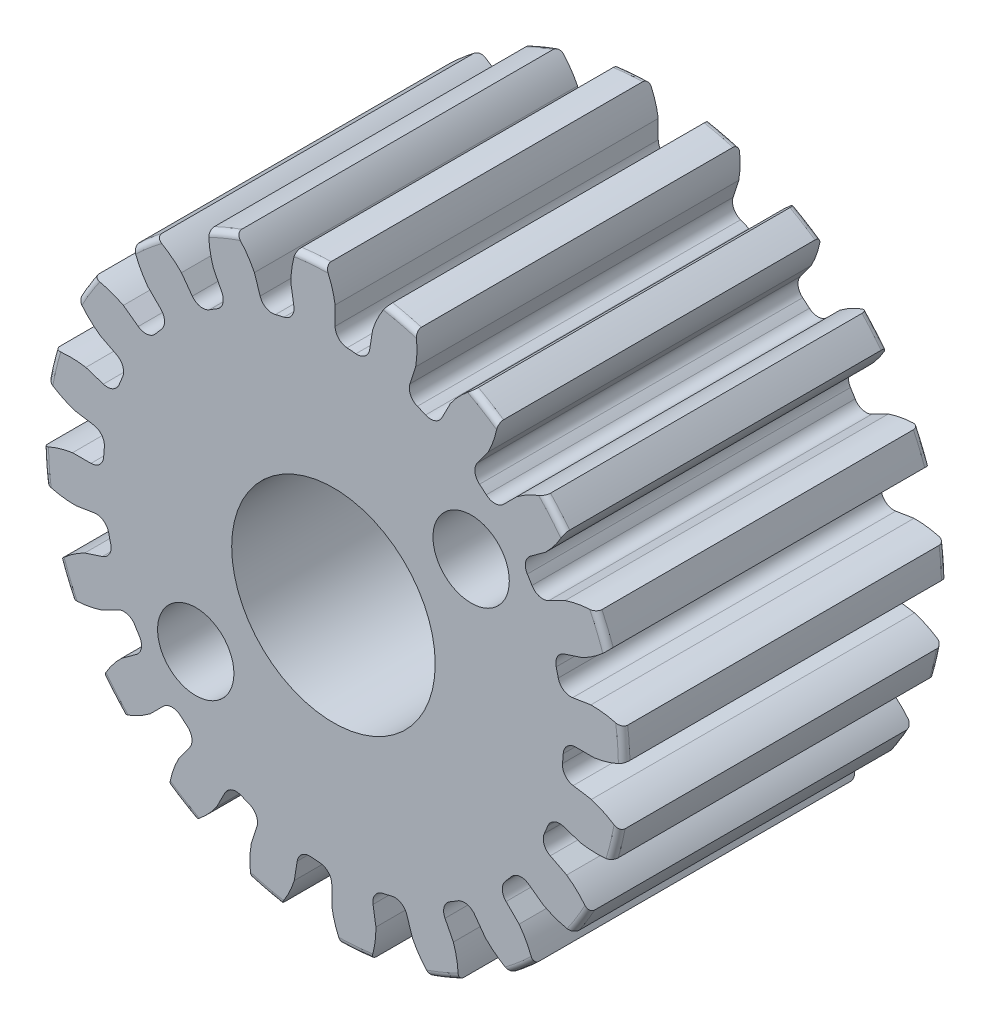
from build123d import *

# Parameters (mm, degrees)
SKETCH1_R           = 5.715
BOSS_EXTRUDE1_DEPTH = 6.35
SKETCH2_W           = 6.35
SKETCH2_H           = 4.7625
FILLET2_R           = 0.1143
CUT_EXTRUDE1_DEPTH  = 6.35
FILLET1_R           = 0.249563992
CIRPATTERN1_START   = -6.35
CIRPATTERN1_DEPTH   = 6.35
SKETCH5_R           = 2
CUT_EXTRUDE2_DEPTH  = 13.489891652
CHAMFER1_SIZE       = 0.238125
CUT_EXTRUDE3_START  = -3.175
SKETCH6_R           = 4.7625
CUT_EXTRUDE3_DEPTH  = 3.175
SKETCH7_R           = 2.238125
SKETCH7_R_2         = 2
BOSS_EXTRUDE2_DEPTH = 6.35
SKETCH8_R           = 0.75
CUT_EXTRUDE4_DEPTH  = 11.275907246


# Read off the part's stored shape, not the designer's step: CirPattern1
with BuildPart() as part:
    # Sketch1 → Boss-Extrude1 (new body)
    with BuildSketch(Plane.XY):
        Circle(SKETCH1_R)
    extrude(amount=-BOSS_EXTRUDE1_DEPTH)

    # Sketch2 → Revolve1 (revolve)
    with BuildSketch(Plane(origin=(0, 0, 0), x_dir=(0, 0, -1), z_dir=(1, 0, 0)), mode=Mode.PRIVATE) as revolve1_sk:
        with Locations((6.35, 2.38125)):
            Rectangle(SKETCH2_W, SKETCH2_H)
    revolve(revolve1_sk.sketch.rotate(Axis((0, 0, -3.175), (0, 0, -1)), 90), axis=Axis((0, 0, -3.175), (0, 0, -1)))

    # Fillet2
    fillet2_edges = [part.edges().sort_by_distance(p)[0] for p in [
        (-5.715, 0, 0),
        (-5.715, 0, -6.35),
    ]]
    fillet(fillet2_edges, radius=FILLET2_R)

    # Sketch4 → Cut-Extrude1 (cut)
    with BuildSketch(Plane.XY):
        with BuildLine():
            Line((0.033105528, 5.127106209), (0.033105528, 4.523301354))
            ThreePointArc((0.033105528, 4.523301354), (0.354904467, 4.509478233), (0.674903926, 4.472790606))
            Line((0.674903926, 4.472790606), (0.769360035, 5.069161587))
            add(Edge.make_bspline(
                [(1.504694003, 6.05479747), (0.955155709, 5.660253512), (0.769360035, 5.069161587)],
                knots=[0, 0, 0, 1, 1, 1], degree=2))
            ThreePointArc((1.504694003, 6.05479747), (0.489504645, 6.219731638), (-0.538987437, 6.215639065))
            add(Edge.make_bspline(
                [(-0.538987437, 6.215639065), (-0.057935318, 5.739985693), (0.033105528, 5.127106209)],
                knots=[0, 0, 0, 1, 1, 1], degree=2))
        make_face()
    extrude(amount=-CUT_EXTRUDE1_DEPTH, mode=Mode.SUBTRACT)

    # Fillet1
    # the kernel refuses this fillet: 0.249563992 mm, written as the material it adds along each edge
    with BuildSketch(Plane(origin=(0.674903926, 4.472790606, 0), x_dir=(-0.9923475631458823, 0.12347596494228733, 0), z_dir=(0, 0, -1))) as fillet1_piece_1:
        with BuildLine():
            CenterArc((0.241394546, 0.249479842), FILLET1_R * 0.999999998397, 181.907267855, 86.6047981)
            Line((-0.008031187, 0.241173865), (0, 0))
            ThreePointArc((0, 0), (0.11745713, 0.001525228), (0.234914261, 0))
        make_face()
    extrude(amount=6.35)
    with BuildSketch(Plane(origin=(0.033105528, 4.523301354, 0), x_dir=(0, 1, 0), z_dir=(0, 0, -1))) as fillet1_piece_2:
        with BuildLine():
            CenterArc((0.241307548, 0.249563992), FILLET1_R * 0.999999998397, 183.3952019, 86.6047981)
            ThreePointArc((-0.007818406, 0.234784119), (-0.00238482, 0.117442822), (0, 0))
            Line((0, 0), (0.241307548, 0))
        make_face()
    extrude(amount=6.35)

    # CirPattern1 outline → CirPattern1 (cut)
    with BuildSketch(Plane.XY.offset(CIRPATTERN1_START)):
        with BuildLine():
            Line((-0.778045262, 4.7007701), (-0.834752203, 5.058804485))
            add(Edge.make_bspline(
                [(-0.834752203, 5.058804485), (-0.837768738, 5.372639768), (-0.736442204, 5.667353642)],
                knots=[0, 0, 0, 0.506532467, 0.506532467, 0.506532467], degree=2))
            ThreePointArc((-0.736442204, 5.667353642), (-1.334139234, 5.557094341), (-1.916747356, 5.383985939))
            add(Edge.make_bspline(
                [(-1.916747356, 5.383985939), (-1.692668104, 5.167396755), (-1.552877722, 4.886397941)],
                knots=[0.493467533, 0.493467533, 0.493467533, 1, 1, 1], degree=2))
            Line((-1.552877722, 4.886397941), (-1.440859894, 4.541642515))
            ThreePointArc((-1.440859894, 4.541642515), (-1.32334776, 4.399852914), (-1.140582774, 4.377261935))
            ThreePointArc((-1.140582774, 4.377261935), (-1.055971203, 4.39844017), (-0.970967017, 4.417983043))
            ThreePointArc((-0.970967017, 4.417983043), (-0.818378274, 4.521085263), (-0.778045262, 4.7007701))
        make_face()
        with BuildLine():
            add(Edge.make_bspline(
                [(2.298161952, 4.583313834), (2.480189275, 4.838984986), (2.735392631, 5.017855276)],
                knots=[0, 0, 0, 0.506532467, 0.506532467, 0.506532467], degree=2))
            ThreePointArc((2.735392631, 5.017855276), (2.187036785, 5.279971125), (1.613946348, 5.482371948))
            add(Edge.make_bspline(
                [(1.613946348, 5.482371948), (1.667922343, 5.17543714), (1.615848179, 4.865937599)],
                knots=[0.493467533, 0.493467533, 0.493467533, 1, 1, 1], degree=2))
            Line((1.615848179, 4.865937599), (1.503830351, 4.521182173))
            ThreePointArc((1.503830351, 4.521182173), (1.515557827, 4.337400077), (1.650139163, 4.211697028))
            ThreePointArc((1.650139163, 4.211697028), (1.731039616, 4.179097147), (1.811296459, 4.144943456))
            ThreePointArc((1.811296459, 4.144943456), (1.995345311, 4.138665491), (2.1335915, 4.260326429))
            Line((2.1335915, 4.260326429), (2.298161952, 4.583313834))
        make_face()
        with BuildLine():
            add(Edge.make_bspline(
                [(3.602003765, 3.648819389), (3.854128768, 3.835727568), (4.152115542, 3.926981149)],
                knots=[0, 0, 0, 0.506532467, 0.506532467, 0.506532467], degree=2))
            ThreePointArc((4.152115542, 3.926981149), (3.711596393, 4.34571941), (3.229100292, 4.715308716))
            add(Edge.make_bspline(
                [(3.229100292, 4.715308716), (3.185586443, 4.406716867), (3.040420352, 4.128457114)],
                knots=[0.493467533, 0.493467533, 0.493467533, 1, 1, 1], degree=2))
            Line((3.040420352, 4.128457114), (2.827349781, 3.835190632))
            ThreePointArc((2.827349781, 3.835190632), (2.781711483, 3.656779483), (2.870861561, 3.495640859))
            ThreePointArc((2.870861561, 3.495640859), (2.937728546, 3.439636914), (3.003503269, 3.382354095))
            ThreePointArc((3.003503269, 3.382354095), (3.176604131, 3.319509174), (3.345679367, 3.392495179))
            Line((3.345679367, 3.392495179), (3.602003765, 3.648819389))
        make_face()
        with BuildLine():
            add(Edge.make_bspline(
                [(4.553256353, 2.357153079), (4.850799284, 2.45700241), (5.162400454, 2.451706746)],
                knots=[0, 0, 0, 0.506532467, 0.506532467, 0.506532467], degree=2))
            ThreePointArc((5.162400454, 2.451706746), (4.872839085, 2.986078401), (4.5281674, 3.486678213))
            add(Edge.make_bspline(
                [(4.5281674, 3.486678213), (4.391423146, 3.206636444), (4.167374997, 2.986854482)],
                knots=[0.493467533, 0.493467533, 0.493467533, 1, 1, 1], degree=2))
            Line((4.167374997, 2.986854482), (3.874108515, 2.773783911))
            ThreePointArc((3.874108515, 2.773783911), (3.775571837, 2.618207834), (3.810564026, 2.437407007))
            ThreePointArc((3.810564026, 2.437407007), (3.856852138, 2.363481056), (3.901706252, 2.28867635))
            ThreePointArc((3.901706252, 2.28867635), (4.046914806, 2.17541617), (4.230268827, 2.192582865))
            Line((4.230268827, 2.192582865), (4.553256353, 2.357153079))
        make_face()
        with BuildLine():
            add(Edge.make_bspline(
                [(5.058804485, 0.834752203), (5.372639768, 0.837768738), (5.667353642, 0.736442204)],
                knots=[0, 0, 0, 0.506532467, 0.506532467, 0.506532467], degree=2))
            ThreePointArc((5.667353642, 0.736442204), (5.557094337, 1.334139233), (5.383985934, 1.916747354))
            add(Edge.make_bspline(
                [(5.383985934, 1.916747354), (5.167396755, 1.692668104), (4.886397941, 1.552877722)],
                knots=[0.493467533, 0.493467533, 0.493467533, 1, 1, 1], degree=2))
            Line((4.886397941, 1.552877722), (4.541642515, 1.440859894))
            ThreePointArc((4.541642515, 1.440859894), (4.399852914, 1.32334776), (4.377261935, 1.140582774))
            ThreePointArc((4.377261935, 1.140582774), (4.39844017, 1.055971203), (4.417983043, 0.970967017))
            ThreePointArc((4.417983043, 0.970967017), (4.521085263, 0.818378274), (4.7007701, 0.778045262))
            Line((4.7007701, 0.778045262), (5.058804485, 0.834752203))
        make_face()
        with BuildLine():
            add(Edge.make_bspline(
                [(5.069161587, -0.769360035), (5.368568838, -0.863471576), (5.617546767, -1.050910431)],
                knots=[0, 0, 0, 0.506532467, 0.506532467, 0.506532467], degree=2))
            ThreePointArc((5.617546767, -1.050910431), (5.697382476, -0.448394778), (5.712782413, 0.15919191))
            add(Edge.make_bspline(
                [(5.712782413, 0.15919191), (5.437549566, 0.013009616), (5.127106209, -0.033105528)],
                knots=[0.493467533, 0.493467533, 0.493467533, 1, 1, 1], degree=2))
            Line((5.127106209, -0.033105528), (4.764608902, -0.033105528))
            ThreePointArc((4.764608902, -0.033105528), (4.593445732, -0.101050812), (4.515482948, -0.267889647))
            ThreePointArc((4.515482948, -0.267889647), (4.509478233, -0.354904467), (4.501796871, -0.441787332))
            ThreePointArc((4.501796871, -0.441787332), (4.552700395, -0.618768189), (4.711127244, -0.712652831))
            Line((4.711127244, -0.712652831), (5.069161587, -0.769360035))
        make_face()
        with BuildLine():
            add(Edge.make_bspline(
                [(4.583313834, -2.298161952), (4.838984986, -2.480189275), (5.017855276, -2.735392631)],
                knots=[0, 0, 0, 0.506532467, 0.506532467, 0.506532467], degree=2))
            ThreePointArc((5.017855276, -2.735392631), (5.279971123, -2.187036784), (5.482371945, -1.613946347))
            add(Edge.make_bspline(
                [(5.482371945, -1.613946347), (5.17543714, -1.667922343), (4.865937599, -1.615848179)],
                knots=[0.493467533, 0.493467533, 0.493467533, 1, 1, 1], degree=2))
            Line((4.865937599, -1.615848179), (4.521182173, -1.503830351))
            ThreePointArc((4.521182173, -1.503830351), (4.337400077, -1.515557827), (4.211697028, -1.650139163))
            ThreePointArc((4.211697028, -1.650139163), (4.179097147, -1.731039616), (4.144943456, -1.811296459))
            ThreePointArc((4.144943456, -1.811296459), (4.138665491, -1.995345311), (4.260326429, -2.1335915))
            Line((4.260326429, -2.1335915), (4.583313834, -2.298161952))
        make_face()
        with BuildLine():
            add(Edge.make_bspline(
                [(3.648819389, -3.602003765), (3.835727568, -3.854128768), (3.926981149, -4.152115542)],
                knots=[0, 0, 0, 0.506532467, 0.506532467, 0.506532467], degree=2))
            ThreePointArc((3.926981149, -4.152115542), (4.345719409, -3.711596392), (4.715308715, -3.229100291))
            add(Edge.make_bspline(
                [(4.715308715, -3.229100291), (4.406716867, -3.185586443), (4.128457114, -3.040420352)],
                knots=[0.493467533, 0.493467533, 0.493467533, 1, 1, 1], degree=2))
            Line((4.128457114, -3.040420352), (3.835190632, -2.827349781))
            ThreePointArc((3.835190632, -2.827349781), (3.656779483, -2.781711483), (3.495640859, -2.870861561))
            ThreePointArc((3.495640859, -2.870861561), (3.439636914, -2.937728546), (3.382354095, -3.003503269))
            ThreePointArc((3.382354095, -3.003503269), (3.319509174, -3.176604131), (3.392495179, -3.345679367))
            Line((3.392495179, -3.345679367), (3.648819389, -3.602003765))
        make_face()
        with BuildLine():
            add(Edge.make_bspline(
                [(2.357153079, -4.553256353), (2.45700241, -4.850799284), (2.451706746, -5.162400454)],
                knots=[0, 0, 0, 0.506532467, 0.506532467, 0.506532467], degree=2))
            ThreePointArc((2.451706746, -5.162400454), (2.986078401, -4.872839086), (3.486678213, -4.528167401))
            add(Edge.make_bspline(
                [(3.486678213, -4.528167401), (3.206636444, -4.391423146), (2.986854482, -4.167374997)],
                knots=[0.493467533, 0.493467533, 0.493467533, 1, 1, 1], degree=2))
            Line((2.986854482, -4.167374997), (2.773783911, -3.874108515))
            ThreePointArc((2.773783911, -3.874108515), (2.618207834, -3.775571837), (2.437407007, -3.810564026))
            ThreePointArc((2.437407007, -3.810564026), (2.363481056, -3.856852138), (2.28867635, -3.901706252))
            ThreePointArc((2.28867635, -3.901706252), (2.17541617, -4.046914806), (2.192582865, -4.230268827))
            Line((2.192582865, -4.230268827), (2.357153079, -4.553256353))
        make_face()
        with BuildLine():
            add(Edge.make_bspline(
                [(0.834752203, -5.058804485), (0.837768738, -5.372639768), (0.736442204, -5.667353642)],
                knots=[0, 0, 0, 0.506532467, 0.506532467, 0.506532467], degree=2))
            ThreePointArc((0.736442204, -5.667353642), (1.334139234, -5.557094339), (1.916747355, -5.383985936))
            add(Edge.make_bspline(
                [(1.916747355, -5.383985936), (1.692668104, -5.167396755), (1.552877722, -4.886397941)],
                knots=[0.493467533, 0.493467533, 0.493467533, 1, 1, 1], degree=2))
            Line((1.552877722, -4.886397941), (1.440859894, -4.541642515))
            ThreePointArc((1.440859894, -4.541642515), (1.32334776, -4.399852914), (1.140582774, -4.377261935))
            ThreePointArc((1.140582774, -4.377261935), (1.055971203, -4.39844017), (0.970967017, -4.417983043))
            ThreePointArc((0.970967017, -4.417983043), (0.818378274, -4.521085263), (0.778045262, -4.7007701))
            Line((0.778045262, -4.7007701), (0.834752203, -5.058804485))
        make_face()
        with BuildLine():
            add(Edge.make_bspline(
                [(-0.769360035, -5.069161587), (-0.863471576, -5.368568838), (-1.050910431, -5.617546767)],
                knots=[0, 0, 0, 0.506532467, 0.506532467, 0.506532467], degree=2))
            ThreePointArc((-1.050910431, -5.617546767), (-0.448394778, -5.69738248), (0.159191911, -5.712782416))
            add(Edge.make_bspline(
                [(0.159191911, -5.712782416), (0.013009616, -5.437549566), (-0.033105528, -5.127106209)],
                knots=[0.493467533, 0.493467533, 0.493467533, 1, 1, 1], degree=2))
            Line((-0.033105528, -5.127106209), (-0.033105528, -4.764608902))
            ThreePointArc((-0.033105528, -4.764608902), (-0.101050812, -4.593445732), (-0.267889647, -4.515482948))
            ThreePointArc((-0.267889647, -4.515482948), (-0.354904467, -4.509478233), (-0.441787332, -4.501796871))
            ThreePointArc((-0.441787332, -4.501796871), (-0.618768189, -4.552700395), (-0.712652831, -4.711127244))
            Line((-0.712652831, -4.711127244), (-0.769360035, -5.069161587))
        make_face()
        with BuildLine():
            add(Edge.make_bspline(
                [(-2.298161952, -4.583313834), (-2.480189275, -4.838984986), (-2.735392631, -5.017855276)],
                knots=[0, 0, 0, 0.506532467, 0.506532467, 0.506532467], degree=2))
            ThreePointArc((-2.735392631, -5.017855276), (-2.187036786, -5.279971128), (-1.613946348, -5.48237195))
            add(Edge.make_bspline(
                [(-1.613946348, -5.48237195), (-1.667922343, -5.17543714), (-1.615848179, -4.865937599)],
                knots=[0.493467533, 0.493467533, 0.493467533, 1, 1, 1], degree=2))
            Line((-1.615848179, -4.865937599), (-1.503830351, -4.521182173))
            ThreePointArc((-1.503830351, -4.521182173), (-1.515557827, -4.337400077), (-1.650139163, -4.211697028))
            ThreePointArc((-1.650139163, -4.211697028), (-1.731039616, -4.179097147), (-1.811296459, -4.144943456))
            ThreePointArc((-1.811296459, -4.144943456), (-1.995345311, -4.138665491), (-2.1335915, -4.260326429))
            Line((-2.1335915, -4.260326429), (-2.298161952, -4.583313834))
        make_face()
        with BuildLine():
            add(Edge.make_bspline(
                [(-3.602003765, -3.648819389), (-3.854128768, -3.835727568), (-4.152115542, -3.926981149)],
                knots=[0, 0, 0, 0.506532467, 0.506532467, 0.506532467], degree=2))
            ThreePointArc((-4.152115542, -3.926981149), (-3.711596396, -4.345719413), (-3.229100294, -4.715308719))
            add(Edge.make_bspline(
                [(-3.229100294, -4.715308719), (-3.185586443, -4.406716867), (-3.040420352, -4.128457114)],
                knots=[0.493467533, 0.493467533, 0.493467533, 1, 1, 1], degree=2))
            Line((-3.040420352, -4.128457114), (-2.827349781, -3.835190632))
            ThreePointArc((-2.827349781, -3.835190632), (-2.781711483, -3.656779483), (-2.870861561, -3.495640859))
            ThreePointArc((-2.870861561, -3.495640859), (-2.937728546, -3.439636914), (-3.003503269, -3.382354095))
            ThreePointArc((-3.003503269, -3.382354095), (-3.176604131, -3.319509174), (-3.345679367, -3.392495179))
            Line((-3.345679367, -3.392495179), (-3.602003765, -3.648819389))
        make_face()
        with BuildLine():
            add(Edge.make_bspline(
                [(-4.553256353, -2.357153079), (-4.850799284, -2.45700241), (-5.162400454, -2.451706746)],
                knots=[0, 0, 0, 0.506532467, 0.506532467, 0.506532467], degree=2))
            ThreePointArc((-5.162400454, -2.451706746), (-4.87283909, -2.986078404), (-4.528167405, -3.486678216))
            add(Edge.make_bspline(
                [(-4.528167405, -3.486678216), (-4.391423146, -3.206636444), (-4.167374997, -2.986854482)],
                knots=[0.493467533, 0.493467533, 0.493467533, 1, 1, 1], degree=2))
            Line((-4.167374997, -2.986854482), (-3.874108515, -2.773783911))
            ThreePointArc((-3.874108515, -2.773783911), (-3.775571837, -2.618207834), (-3.810564026, -2.437407007))
            ThreePointArc((-3.810564026, -2.437407007), (-3.856852138, -2.363481056), (-3.901706252, -2.28867635))
            ThreePointArc((-3.901706252, -2.28867635), (-4.046914806, -2.17541617), (-4.230268827, -2.192582865))
            Line((-4.230268827, -2.192582865), (-4.553256353, -2.357153079))
        make_face()
        with BuildLine():
            add(Edge.make_bspline(
                [(-5.058804485, -0.834752203), (-5.372639768, -0.837768738), (-5.667353642, -0.736442204)],
                knots=[0, 0, 0, 0.506532467, 0.506532467, 0.506532467], degree=2))
            ThreePointArc((-5.667353642, -0.736442204), (-5.557094343, -1.334139235), (-5.383985941, -1.916747357))
            add(Edge.make_bspline(
                [(-5.383985941, -1.916747357), (-5.167396755, -1.692668104), (-4.886397941, -1.552877722)],
                knots=[0.493467533, 0.493467533, 0.493467533, 1, 1, 1], degree=2))
            Line((-4.886397941, -1.552877722), (-4.541642515, -1.440859894))
            ThreePointArc((-4.541642515, -1.440859894), (-4.399852914, -1.32334776), (-4.377261935, -1.140582774))
            ThreePointArc((-4.377261935, -1.140582774), (-4.39844017, -1.055971203), (-4.417983043, -0.970967017))
            ThreePointArc((-4.417983043, -0.970967017), (-4.521085263, -0.818378274), (-4.7007701, -0.778045262))
            Line((-4.7007701, -0.778045262), (-5.058804485, -0.834752203))
        make_face()
        with BuildLine():
            add(Edge.make_bspline(
                [(-5.069161587, 0.769360035), (-5.368568838, 0.863471576), (-5.617546767, 1.050910431)],
                knots=[0, 0, 0, 0.506532467, 0.506532467, 0.506532467], degree=2))
            ThreePointArc((-5.617546767, 1.050910431), (-5.697382484, 0.448394779), (-5.71278242, -0.159191911))
            add(Edge.make_bspline(
                [(-5.71278242, -0.159191911), (-5.437549566, -0.013009616), (-5.127106209, 0.033105528)],
                knots=[0.493467533, 0.493467533, 0.493467533, 1, 1, 1], degree=2))
            Line((-5.127106209, 0.033105528), (-4.764608902, 0.033105528))
            ThreePointArc((-4.764608902, 0.033105528), (-4.593445732, 0.101050812), (-4.515482948, 0.267889647))
            ThreePointArc((-4.515482948, 0.267889647), (-4.509478233, 0.354904467), (-4.501796871, 0.441787332))
            ThreePointArc((-4.501796871, 0.441787332), (-4.552700395, 0.618768189), (-4.711127244, 0.712652831))
            Line((-4.711127244, 0.712652831), (-5.069161587, 0.769360035))
        make_face()
        with BuildLine():
            add(Edge.make_bspline(
                [(-4.583313834, 2.298161952), (-4.838984986, 2.480189275), (-5.017855276, 2.735392631)],
                knots=[0, 0, 0, 0.506532467, 0.506532467, 0.506532467], degree=2))
            ThreePointArc((-5.017855276, 2.735392631), (-5.27997113, 2.187036787), (-5.482371952, 1.613946349))
            add(Edge.make_bspline(
                [(-5.482371952, 1.613946349), (-5.17543714, 1.667922343), (-4.865937599, 1.615848179)],
                knots=[0.493467533, 0.493467533, 0.493467533, 1, 1, 1], degree=2))
            Line((-4.865937599, 1.615848179), (-4.521182173, 1.503830351))
            ThreePointArc((-4.521182173, 1.503830351), (-4.337400077, 1.515557827), (-4.211697028, 1.650139163))
            ThreePointArc((-4.211697028, 1.650139163), (-4.179097147, 1.731039616), (-4.144943456, 1.811296459))
            ThreePointArc((-4.144943456, 1.811296459), (-4.138665491, 1.995345311), (-4.260326429, 2.1335915))
            Line((-4.260326429, 2.1335915), (-4.583313834, 2.298161952))
        make_face()
        with BuildLine():
            add(Edge.make_bspline(
                [(-3.648819389, 3.602003765), (-3.835727568, 3.854128768), (-3.926981149, 4.152115542)],
                knots=[0, 0, 0, 0.506532467, 0.506532467, 0.506532467], degree=2))
            ThreePointArc((-3.926981149, 4.152115542), (-4.345719414, 3.711596396), (-4.71530872, 3.229100295))
            add(Edge.make_bspline(
                [(-4.71530872, 3.229100295), (-4.406716867, 3.185586443), (-4.128457114, 3.040420352)],
                knots=[0.493467533, 0.493467533, 0.493467533, 1, 1, 1], degree=2))
            Line((-4.128457114, 3.040420352), (-3.835190632, 2.827349781))
            ThreePointArc((-3.835190632, 2.827349781), (-3.656779483, 2.781711483), (-3.495640859, 2.870861561))
            ThreePointArc((-3.495640859, 2.870861561), (-3.439636914, 2.937728546), (-3.382354095, 3.003503269))
            ThreePointArc((-3.382354095, 3.003503269), (-3.319509174, 3.176604131), (-3.392495179, 3.345679367))
            Line((-3.392495179, 3.345679367), (-3.648819389, 3.602003765))
        make_face()
        with BuildLine():
            add(Edge.make_bspline(
                [(-2.357153079, 4.553256353), (-2.45700241, 4.850799284), (-2.451706746, 5.162400454)],
                knots=[0, 0, 0, 0.506532467, 0.506532467, 0.506532467], degree=2))
            ThreePointArc((-2.451706746, 5.162400454), (-2.986078403, 4.872839089), (-3.486678216, 4.528167404))
            add(Edge.make_bspline(
                [(-3.486678216, 4.528167404), (-3.206636444, 4.391423146), (-2.986854482, 4.167374997)],
                knots=[0.493467533, 0.493467533, 0.493467533, 1, 1, 1], degree=2))
            Line((-2.986854482, 4.167374997), (-2.773783911, 3.874108515))
            ThreePointArc((-2.773783911, 3.874108515), (-2.618207834, 3.775571837), (-2.437407007, 3.810564026))
            ThreePointArc((-2.437407007, 3.810564026), (-2.363481056, 3.856852138), (-2.28867635, 3.901706252))
            ThreePointArc((-2.28867635, 3.901706252), (-2.17541617, 4.046914806), (-2.192582865, 4.230268827))
            Line((-2.192582865, 4.230268827), (-2.357153079, 4.553256353))
        make_face()
    extrude(amount=CIRPATTERN1_DEPTH, mode=Mode.SUBTRACT)

    # Sketch5 → Cut-Extrude2 (cut, through all)
    with BuildSketch(Plane.XY):
        Circle(SKETCH5_R)
    extrude(amount=-CUT_EXTRUDE2_DEPTH, mode=Mode.SUBTRACT)

    # Chamfer1
    chamfer1_edges = [part.edges().sort_by_distance(p)[0] for p in [
        (-4.7625, 0, -9.525),
        (-2, 0, -9.525),
        (-2, 0, 0),
    ]]
    chamfer(chamfer1_edges, length=CHAMFER1_SIZE)

    # Sketch6 → Cut-Extrude3 (cut)
    with BuildSketch(Plane(origin=(0, 0, -9.525), x_dir=(-1, 0, 0), z_dir=(0, 0, -1)).offset(CUT_EXTRUDE3_START)):
        Circle(SKETCH6_R)
    extrude(amount=CUT_EXTRUDE3_DEPTH, mode=Mode.SUBTRACT)

    # Sketch7 → Boss-Extrude2 (add)
    with BuildSketch(Plane.XY):
        Circle(SKETCH7_R)
        Circle(SKETCH7_R_2, mode=Mode.SUBTRACT)
    extrude(amount=-BOSS_EXTRUDE2_DEPTH)

    # Sketch8 → Cut-Extrude4 (cut, through all)
    with BuildSketch(Plane.XY):
        with Locations((-2.705841104, -2.140309305)):
            Circle(SKETCH8_R)
        with Locations((2.705841104, 2.140309305)):
            Circle(SKETCH8_R)
    extrude(amount=-CUT_EXTRUDE4_DEPTH, mode=Mode.SUBTRACT)


solid = part.part
